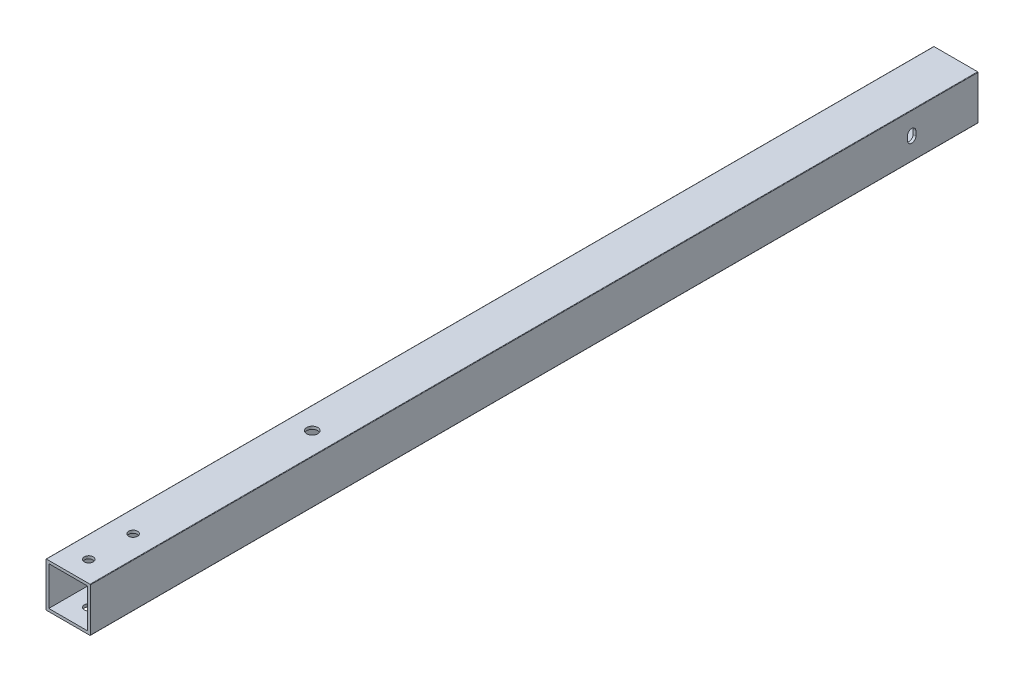
from build123d import *

# Parameters (mm, degrees)
SKETCH1_W           = 22.225
SKETCH1_H           = 22.225
BOSS_EXTRUDE1_DEPTH = 508
CUT_EXTRUDE2_DEPTH  = 510.191707666
SKETCH6_R           = 3.175
CUT_EXTRUDE4_DEPTH  = 510.191707666
SKETCH7_R           = 2.54
CUT_EXTRUDE5_DEPTH  = 510.191707666


with BuildPart() as part:
    # Sketch1 → Boss-Extrude1 (new body)
    with BuildSketch(Plane(origin=(0, 0, 0), x_dir=(-1, 0, 0), z_dir=(0, 0, -1))):
        with BuildLine():
            Line((1.5875, -1.3335), (1.5875, 23.5585))
            ThreePointArc((1.5875, 23.5585), (1.513105122, 23.738105122), (1.3335, 23.8125))
            Line((1.3335, 23.8125), (-23.5585, 23.8125))
            ThreePointArc((-23.5585, 23.8125), (-23.738105122, 23.738105122), (-23.8125, 23.5585))
            Line((-23.8125, 23.5585), (-23.8125, -1.3335))
            ThreePointArc((-23.8125, -1.3335), (-23.738105122, -1.513105122), (-23.5585, -1.5875))
            Line((-23.5585, -1.5875), (1.3335, -1.5875))
            ThreePointArc((1.3335, -1.5875), (1.513105122, -1.513105122), (1.5875, -1.3335))
        make_face()
        with Locations((-11.1125, 11.1125)):
            Rectangle(SKETCH1_W, SKETCH1_H, mode=Mode.SUBTRACT)
    extrude(amount=-BOSS_EXTRUDE1_DEPTH)

    # Sketch4 → Cut-Extrude2 (cut, through all)
    with BuildSketch(Plane(origin=(23.8125, 0, 0), x_dir=(0, 0, -1), z_dir=(1, 0, 0))):
        with BuildLine():
            ThreePointArc((-40.314518304, 9.8425), (-37.933268304, 7.46125), (-35.552018304, 9.8425))
            Line((-35.552018304, 9.8425), (-35.552018304, 12.3825))
            ThreePointArc((-35.552018304, 12.3825), (-37.933268304, 14.76375), (-40.314518304, 12.3825))
            Line((-40.314518304, 12.3825), (-40.314518304, 9.8425))
        make_face()
    extrude(amount=-CUT_EXTRUDE2_DEPTH, mode=Mode.SUBTRACT)

    # Sketch6 → Cut-Extrude4 (cut, through all)
    with BuildSketch(Plane.XZ.offset(1.5875)):
        with Locations((11.1125, 368.3)):
            Circle(SKETCH6_R)
    extrude(amount=-CUT_EXTRUDE4_DEPTH, mode=Mode.SUBTRACT)

    # Sketch7 → Cut-Extrude5 (cut, through all)
    with BuildSketch(Plane.XZ.offset(1.5875)):
        with Locations((10.9125, 470.65)):
            Circle(SKETCH7_R)
        with Locations((10.9125, 496.05)):
            Circle(SKETCH7_R)
    extrude(amount=-CUT_EXTRUDE5_DEPTH, mode=Mode.SUBTRACT)


solid = part.part
